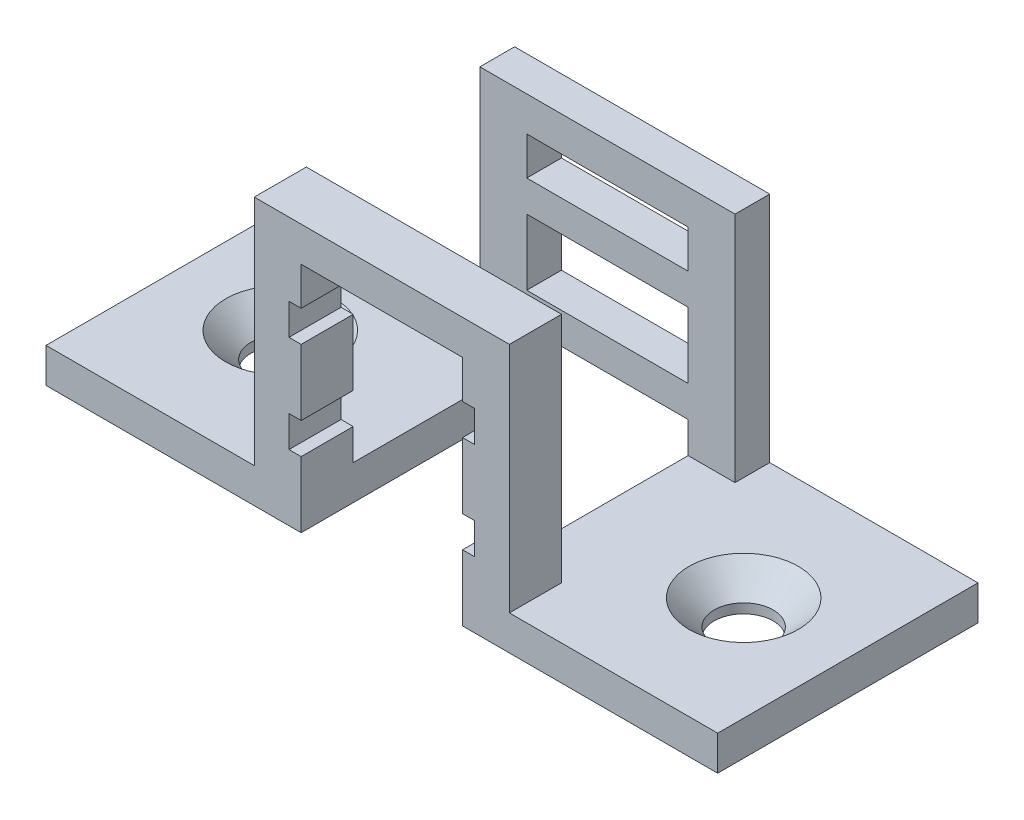
from build123d import *

# Parameters (mm, degrees)
SKETCH1_W                = 14.7
SKETCH1_H                = 15
BOSS_EXTRUDE1_DEPTH      = 15.4
SKETCH2_W                = 10.7
SKETCH2_H                = 14.684086862
CUT_EXTRUDE1_DEPTH       = 13
SKETCH4_W                = 2.7
SKETCH4_H                = 3.8
BOSS_EXTRUDE2_DEPTH      = 3
SKETCH5_W                = 10
SKETCH5_H                = 13.4
CUT_EXTRUDE2_DEPTH       = 23.572106681
SKETCH6_W                = 9.3
SKETCH6_H                = 3.8
SKETCH6_H_2              = 2.2
CUT_EXTRUDE3_DEPTH       = 23.719650085
BOSS_EXTRUDE3_DEPTH      = 12
BOSS_EXTRUDE3_DEPTH_BACK = 2.7
SKETCH7_W                = 15
SKETCH7_H                = 2
BOSS_EXTRUDE4_DEPTH      = 12
BOSS_EXTRUDE4_DEPTH_BACK = 2.7
SKETCH8_W                = 15
SKETCH8_H                = 2


with BuildPart() as part:
    # Sketch1 → Boss-Extrude1 (new body)
    with BuildSketch(Plane(origin=(0, 0, 0), x_dir=(1, 0, 0), z_dir=(0, 1, 0))):
        Rectangle(SKETCH1_W, SKETCH1_H)
    extrude(amount=BOSS_EXTRUDE1_DEPTH)

    # Sketch2 → Cut-Extrude1 (cut)
    with BuildSketch(Plane.XY.offset(7.5)):
        with Locations((0, 6.057956569)):
            Rectangle(SKETCH2_W, SKETCH2_H)
    extrude(amount=-CUT_EXTRUDE1_DEPTH, mode=Mode.SUBTRACT)

    # Sketch4 → Boss-Extrude2 (add)
    with BuildSketch(Plane.XY.offset(7.5)):
        with Locations((-6, 7.5)):
            Rectangle(SKETCH4_W, SKETCH4_H)
        with Locations((-6, 13.1)):
            Rectangle(SKETCH4_W, SKETCH4_H)
        with Locations((6, 13.1)):
            Rectangle(SKETCH4_W, SKETCH4_H)
        with Locations((6, 7.5)):
            Rectangle(SKETCH4_W, SKETCH4_H)
        with Locations((-6, 1.9)):
            Rectangle(SKETCH4_W, SKETCH4_H)
        with Locations((6, 1.9)):
            Rectangle(SKETCH4_W, SKETCH4_H)
    extrude(amount=-BOSS_EXTRUDE2_DEPTH)

    # Sketch5 → Cut-Extrude2 (cut, through all)
    with BuildSketch(Plane(origin=(7.35, 0, 0), x_dir=(0, 0, -1), z_dir=(1, 0, 0))):
        with Locations((0.5, 8.7)):
            Rectangle(SKETCH5_W, SKETCH5_H)
    extrude(amount=-CUT_EXTRUDE2_DEPTH, mode=Mode.SUBTRACT)

    # Sketch6 → Cut-Extrude3 (cut, through all)
    with BuildSketch(Plane.XY.offset(7.5)):
        with Locations((0, 7.5)):
            Rectangle(SKETCH6_W, SKETCH6_H)
        with Locations((0, 1.9)):
            Rectangle(SKETCH6_W, SKETCH6_H)
        with Locations((0, 12.3)):
            Rectangle(SKETCH6_W, SKETCH6_H_2)
    extrude(amount=-CUT_EXTRUDE3_DEPTH, mode=Mode.SUBTRACT)

    # Sketch7 → Boss-Extrude3 (add, two sides: drawn at the far end of the back side and taken through both)
    with BuildSketch(Plane.ZY.offset(7.35).offset(-BOSS_EXTRUDE3_DEPTH_BACK)):
        with Locations((0, 1)):
            Rectangle(SKETCH7_W, SKETCH7_H)
    extrude(amount=BOSS_EXTRUDE3_DEPTH + BOSS_EXTRUDE3_DEPTH_BACK)

    # Sketch8 → Boss-Extrude4 (add, two sides: drawn at the far end of the back side and taken through both)
    with BuildSketch(Plane(origin=(7.35, 0, 0), x_dir=(0, 0, -1), z_dir=(1, 0, 0)).offset(-BOSS_EXTRUDE4_DEPTH_BACK)):
        with Locations((0, 1)):
            Rectangle(SKETCH8_W, SKETCH8_H)
    extrude(amount=BOSS_EXTRUDE4_DEPTH + BOSS_EXTRUDE4_DEPTH_BACK)

    # Sketch10 → CSK for M3 Flat Head Machine Screw1 (revolve, cut)
    with BuildSketch(Plane(origin=(-13.35, 2, 0), x_dir=(0, 0, 1), z_dir=(1, 0, 0))):
        Polygon((0, 0), (0, 2), (1.7, 2), (1.7, 1.45), (3.15, 0), align=None)
    revolve(axis=Axis((-13.35, 8.35, 0), (0, -1, 0)), mode=Mode.SUBTRACT)

    # Sketch12 → CSK for M3 Flat Head Machine Screw2 (revolve, cut)
    with BuildSketch(Plane(origin=(13.35, 2, 0), x_dir=(0, 0, 1), z_dir=(1, 0, 0))):
        Polygon((0, 0), (0, 2), (1.7, 2), (1.7, 1.45), (3.15, 0), align=None)
    revolve(axis=Axis((13.35, 8.35, 0), (0, -1, 0)), mode=Mode.SUBTRACT)


solid = part.part
